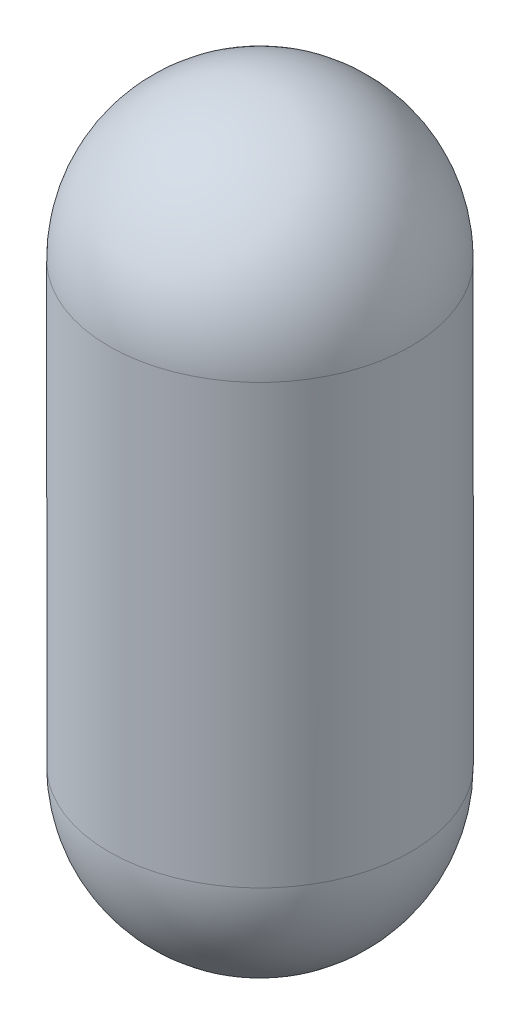
from build123d import *

# Parameters (mm, degrees)
SHELL1_T = 0.77


with BuildPart() as part:
    # Sketch1 → Revolve1 (revolve)
    with BuildSketch(Plane.XY):
        with BuildLine():
            Line((-510, -510), (-510, -1990))
            ThreePointArc((-510, -1990), (-360.624458405, -2350.624458405), (0, -2500))
            Line((0, -2500), (0, 0))
            ThreePointArc((0, 0), (-360.624458405, -149.375541595), (-510, -510))
        make_face()
    revolve(axis=Axis((0, 0, 0), (0, -1, 0)))

    # Shell1 (no face opened: a closed hollow body)
    add(offset(amount=-SHELL1_T, mode=Mode.PRIVATE), mode=Mode.SUBTRACT)


solid = part.part
